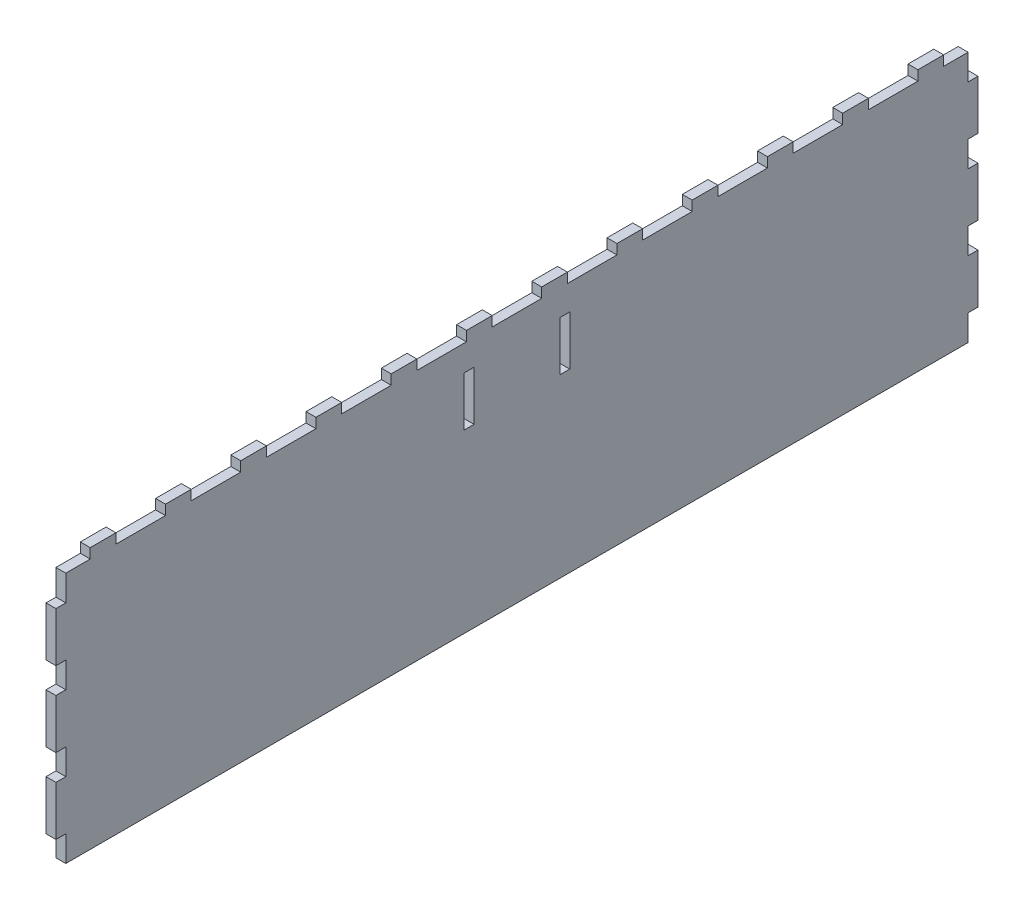
from build123d import *

# Parameters (mm, degrees)
SKETCH1_W               = 279.4
SKETCH1_H               = 76.2
BOSS_EXTRUDE1_DEPTH     = 3
SKETCH3_W               = 3
SKETCH3_H               = 7.8
CUT_EXTRUDE1_DEPTH      = 145.833352512
LPATTERN1_COUNT         = 4
LPATTERN1_PITCH         = 22.8
MIRROR1_COPY_1_SKETCH_W = 3
MIRROR1_COPY_1_SKETCH_H = 7.8
MIRROR1_COPY_1_DEPTH    = 145.833352512
MIRROR1_COPY_2_SKETCH_W = 3
MIRROR1_COPY_2_SKETCH_H = 7.8
MIRROR1_COPY_2_DEPTH    = 145.833352512
MIRROR1_COPY_3_SKETCH_W = 3
MIRROR1_COPY_3_SKETCH_H = 7.8
MIRROR1_COPY_3_DEPTH    = 145.833352512
MIRROR1_COPY_4_SKETCH_W = 3
MIRROR1_COPY_4_SKETCH_H = 7.8
MIRROR1_COPY_4_DEPTH    = 145.833352512
SKETCH5_W               = 3
SKETCH5_H               = 15
CUT_EXTRUDE3_DEPTH      = 10
SKETCH9_W               = 3
SKETCH9_H               = 7.8
BOSS_EXTRUDE2_DEPTH     = 3
LPATTERN4_COUNT         = 12
LPATTERN4_PITCH         = 22.8


with BuildPart() as part:
    # Sketch1 → Boss-Extrude1 (new body)
    with BuildSketch(Plane(origin=(0, 0, 0), x_dir=(0, 0, -1), z_dir=(1, 0, 0))):
        Rectangle(SKETCH1_W, SKETCH1_H)
    extrude(amount=-BOSS_EXTRUDE1_DEPTH)

    # Sketch3 → Cut-Extrude1 (cut, through all)
    with BuildSketch(Plane.ZY.offset(3)):
        with Locations((-138.2, 34.2)):
            Rectangle(SKETCH3_W, SKETCH3_H)
    cut_extrude1 = extrude(amount=-CUT_EXTRUDE1_DEPTH, mode=Mode.SUBTRACT)

    # LPattern1: Cut-Extrude1 ×4
    with Locations(*[(0, -i * LPATTERN1_PITCH, 0) for i in range(1, LPATTERN1_COUNT)]):
        add(cut_extrude1, mode=Mode.SUBTRACT)

    # Mirror1 copy 1 sketch → Mirror1 copy 1 (cut, through all)
    with BuildSketch(Plane(origin=(-3, -22.8, 0), x_dir=(0, 0, -1), z_dir=(-1, 0, 0))):
        with Locations((-138.2, -34.2)):
            Rectangle(MIRROR1_COPY_1_SKETCH_W, MIRROR1_COPY_1_SKETCH_H)
    extrude(amount=-MIRROR1_COPY_1_DEPTH, mode=Mode.SUBTRACT)

    # Mirror1 copy 2 sketch → Mirror1 copy 2 (cut, through all)
    with BuildSketch(Plane(origin=(-3, -45.6, 0), x_dir=(0, 0, -1), z_dir=(-1, 0, 0))):
        with Locations((-138.2, -34.2)):
            Rectangle(MIRROR1_COPY_2_SKETCH_W, MIRROR1_COPY_2_SKETCH_H)
    extrude(amount=-MIRROR1_COPY_2_DEPTH, mode=Mode.SUBTRACT)

    # Mirror1 copy 3 sketch → Mirror1 copy 3 (cut, through all)
    with BuildSketch(Plane(origin=(-3, -68.4, 0), x_dir=(0, 0, -1), z_dir=(-1, 0, 0))):
        with Locations((-138.2, -34.2)):
            Rectangle(MIRROR1_COPY_3_SKETCH_W, MIRROR1_COPY_3_SKETCH_H)
    extrude(amount=-MIRROR1_COPY_3_DEPTH, mode=Mode.SUBTRACT)

    # Mirror1 copy 4 sketch → Mirror1 copy 4 (cut, through all)
    with BuildSketch(Plane(origin=(-3, 0, 0), x_dir=(0, 0, -1), z_dir=(-1, 0, 0))):
        with Locations((-138.2, -34.2)):
            Rectangle(MIRROR1_COPY_4_SKETCH_W, MIRROR1_COPY_4_SKETCH_H)
    extrude(amount=-MIRROR1_COPY_4_DEPTH, mode=Mode.SUBTRACT)

    # Sketch5 → Cut-Extrude3 (cut)
    with BuildSketch(Plane.ZY.offset(3)):
        with Locations((-14.5, 22.8)):
            Rectangle(SKETCH5_W, SKETCH5_H)
    cut_extrude3 = extrude(amount=-CUT_EXTRUDE3_DEPTH, mode=Mode.SUBTRACT)

    # Mirror2: Cut-Extrude3 across plane
    add(cut_extrude3.mirror(Plane.XY), mode=Mode.SUBTRACT)

    # Sketch9 → Boss-Extrude2 (add)
    with BuildSketch(Plane(origin=(0, 38.1, 0), x_dir=(1, 0, 0), z_dir=(0, 1, 0))):
        with Locations((-1.5, 125.4)):
            Rectangle(SKETCH9_W, SKETCH9_H)
    boss_extrude2 = extrude(amount=BOSS_EXTRUDE2_DEPTH)

    # LPattern4: Boss-Extrude2 ×12
    with Locations(*[(0, 0, i * LPATTERN4_PITCH) for i in range(1, LPATTERN4_COUNT)]):
        add(boss_extrude2)


solid = part.part
